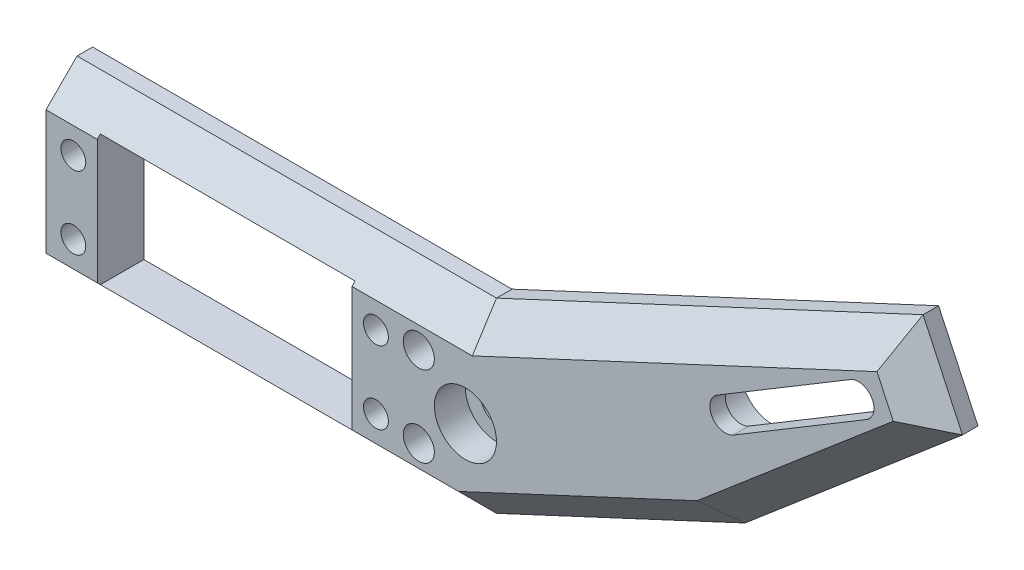
from build123d import *

# Parameters (mm, degrees)
SKETCH1_W                = 57.5
SKETCH1_H                = 30
BOSS_EXTRUDE1_DEPTH      = 30
SKETCH2_W                = 41
SKETCH2_H                = 21
CUT_EXTRUDE1_DEPTH       = 25
SKETCH8_R                = 2
CUT_EXTRUDE6_DEPTH       = 10
SKETCH10_R               = 5
CUT_EXTRUDE8_DEPTH       = 10
BOSS_EXTRUDE4_DEPTH      = 30
SKETCH16_R               = 5
CUT_EXTRUDE10_DEPTH      = 30
CHAMFER5_SIZE            = 5
SKETCH19_R               = 2.5
CUT_EXTRUDE12_DEPTH      = 30
SKETCH20_R               = 7.5
CUT_EXTRUDE13_DEPTH      = 2.5
CUT_EXTRUDE15_DEPTH      = 122.918629513
CUT_EXTRUDE15_DEPTH_BACK = 122.918629513
SKETCH29_W               = 67.5
SKETCH29_H               = 17.5
CUT_EXTRUDE16_DEPTH      = 124.312257678
SKETCH32_R               = 5
CUT_EXTRUDE18_DEPTH      = 5
CUT_EXTRUDE19_DEPTH      = 5


with BuildPart() as part:
    # Sketch1 → Boss-Extrude1 (new body)
    with BuildSketch(Plane.XY):
        Rectangle(SKETCH1_W, SKETCH1_H)
    extrude(amount=BOSS_EXTRUDE1_DEPTH)

    # Sketch2 → Cut-Extrude1 (cut)
    with BuildSketch(Plane.XY.offset(30)):
        Rectangle(SKETCH2_W, SKETCH2_H)
    extrude(amount=-CUT_EXTRUDE1_DEPTH, mode=Mode.SUBTRACT)

    # Sketch8 → Cut-Extrude6 (cut)
    with BuildSketch(Plane.XY.offset(30)):
        with Locations((24.35, 5.85)):
            Circle(SKETCH8_R)
        with Locations(Location((24.35, -5.85, 0), (0, 0, 180))):
            Circle(SKETCH8_R)
        with Locations((-24.35, -5.85)):
            Circle(SKETCH8_R)
        with Locations(Location((-24.35, 5.85, 0), (0, 0, 180))):
            Circle(SKETCH8_R)
    extrude(amount=-CUT_EXTRUDE6_DEPTH, mode=Mode.SUBTRACT)

    # Sketch10 → Cut-Extrude8 (cut)
    with BuildSketch(Plane.XY.offset(5)):
        with Locations((-10, 0)):
            Circle(SKETCH10_R)
    extrude(amount=-CUT_EXTRUDE8_DEPTH, mode=Mode.SUBTRACT)

    # Sketch13 → Boss-Extrude4 (add)
    with BuildSketch(Plane.XY.offset(30)):
        Polygon((28.75, 15), (38.75, 15), (107.410726074, 47.017022383), (113.75, 33.422405577), (78.75, 3.652306326), (38.75, -15), (28.75, -15), align=None)
    extrude(amount=-BOSS_EXTRUDE4_DEPTH)

    # Sketch16 → Cut-Extrude10 (cut)
    with BuildSketch(Plane(origin=(1.175656739, -2.521204013, 0), x_dir=(0.9063077870366488, 0.42261826174070183, 0), z_dir=(-0.42261826174070183, 0.9063077870366488, 0))):
        with Locations(Location((97.217429724, -15, 0), (0, 0, 180))):
            Circle(SKETCH16_R)
        with BuildLine():
            Line((67.217429724, -12.5), (82.217429724, -12.5))
            ThreePointArc((82.217429724, -12.5), (84.717429724, -15), (82.217429724, -17.5))
            Line((82.217429724, -17.5), (67.217429724, -17.5))
            ThreePointArc((67.217429724, -17.5), (64.717429724, -15), (67.217429724, -12.5))
        make_face()
    extrude(amount=-CUT_EXTRUDE10_DEPTH, mode=Mode.SUBTRACT)

    # Chamfer5
    # the kernel refuses this chamfer: 5 mm, written as the material it takes off along each edge
    with BuildSketch(Plane(origin=(-28.75, 27.85841494, 0), x_dir=(-0.027495876610586317, 0, 0.9996219169112968), z_dir=(0, -1, 0))) as chamfer5_piece_1:
        Polygon((CHAMFER5_SIZE * 0.999621916911, -CHAMFER5_SIZE * 0.0274958766106), (-CHAMFER5_SIZE * 0.0274958766106, -CHAMFER5_SIZE * 0.999621916911), (0, 0), align=None)
    extrude(amount=55.71682988, mode=Mode.SUBTRACT)
    with BuildSketch(Plane(origin=(-41.60841494, -15, 0), x_dir=(0, -0.027495876610586317, 0.9996219169112968), z_dir=(1, 0, 0)), Plane(origin=(51.60841494, -15, 30), x_dir=(0, -0.027495876610586317, -0.9996219169112968), z_dir=(-1, 0, 0))) as chamfer5_piece_2:
        Polygon((CHAMFER5_SIZE * 0.999621916911, -CHAMFER5_SIZE * 0.0274958766106), (-CHAMFER5_SIZE * 0.0274958766106, -CHAMFER5_SIZE * 0.999621916911), (0, 0), align=None)
    extrude(amount=93.21682988, mode=Mode.SUBTRACT)
    with BuildSketch(Plane(origin=(90.403681589, 9.086507297, 0), x_dir=(0.011620259578202724, -0.024919727083573626, 0.9996219169112968), z_dir=(-0.9063077870366526, -0.4226182617406939, 0)), Plane(origin=(90.403681589, 9.086507297, 30), x_dir=(-0.4224584769229526, 0.905965127389214, 0.02749587661058631), z_dir=(-0.9063077870366526, -0.4226182617406939, 0))) as chamfer5_piece_3:
        Polygon((CHAMFER5_SIZE * 0.999621916911, CHAMFER5_SIZE * 0.0274958766106), (-CHAMFER5_SIZE * 0.0274958766106, CHAMFER5_SIZE * 0.999621916911), (0, 0), align=None)
    extrude(amount=69.851946638, mode=Mode.SUBTRACT)
    with BuildSketch(Plane(origin=(123.544555766, 41.753402643, 0), x_dir=(-0.6476573741944397, 0.7614354223576539, -0.027495876610586414), z_dir=(-0.7617234170999287, -0.6479023351104763, 0))) as chamfer5_piece_4:
        Polygon((CHAMFER5_SIZE * 0.999621916911, -CHAMFER5_SIZE * 0.0274958766106), (-CHAMFER5_SIZE * 0.0274958766106, -CHAMFER5_SIZE * 0.999621916911), (0, 0), align=None)
    extrude(amount=71.665266299, mode=Mode.SUBTRACT)
    with BuildSketch(Plane(origin=(101.976525103, 58.670703972, 0), x_dir=(-0.9059651273892108, -0.42245847692295924, -0.027495876610586344), z_dir=(0.42261826174070055, -0.9063077870366495, 0))) as chamfer5_piece_5:
        Polygon((CHAMFER5_SIZE * 0.999621916911, -CHAMFER5_SIZE * 0.0274958766106), (-CHAMFER5_SIZE * 0.0274958766106, -CHAMFER5_SIZE * 0.999621916911), (0, 0), align=None)
    extrude(amount=40.71682988, mode=Mode.SUBTRACT)
    with BuildSketch(Plane(origin=(27.096318411, 9.565799029, 0), x_dir=(0.4224584769229604, -0.9059651273892103, -0.02749587661058636), z_dir=(0.9063077870366489, 0.4226182617407018, 0))) as chamfer5_piece_6_section:
        Polygon((CHAMFER5_SIZE * 0.999621916911, -CHAMFER5_SIZE * 0.0274958766106), (-CHAMFER5_SIZE * 0.0274958766106, -CHAMFER5_SIZE * 0.999621916911), (0, 0), align=None)
    chamfer5_piece_6 = extrude(amount=101.47555893, mode=Mode.PRIVATE)
    chamfer5_piece_6 = split(chamfer5_piece_6, bisect_by=Plane(origin=(81.150743587, 15, 1.670360501), z_dir=(0, 1, 0)), keep=Keep.TOP, mode=Mode.PRIVATE)
    add(chamfer5_piece_6, mode=Mode.SUBTRACT)
    with BuildSketch(Plane(origin=(-41.60841494, 15, 0), x_dir=(0, -0.9996219169112968, -0.027495876610586372), z_dir=(1, 0, 0))) as chamfer5_piece_7_section:
        Polygon((CHAMFER5_SIZE * 0.999621916911, -CHAMFER5_SIZE * 0.0274958766106), (-CHAMFER5_SIZE * 0.0274958766106, -CHAMFER5_SIZE * 0.999621916911), (0, 0), align=None)
    chamfer5_piece_7 = extrude(amount=93.21682988, mode=Mode.PRIVATE)
    chamfer5_piece_7 = split(chamfer5_piece_7, bisect_by=Plane(origin=(3.719146846, -1.335155097, 1.672660276), z_dir=(-0.4226182617407018, 0.9063077870366489, 0)), keep=Keep.TOP, mode=Mode.PRIVATE)
    add(chamfer5_piece_7, mode=Mode.SUBTRACT)
    with BuildSketch(Plane(origin=(51.60841494, 15, 30), x_dir=(0, -0.9996219169112968, 0.027495876610586317), z_dir=(-1, 0, 0))) as chamfer5_piece_8_section:
        Polygon((CHAMFER5_SIZE * 0.999621916911, -CHAMFER5_SIZE * 0.0274958766106), (-CHAMFER5_SIZE * 0.0274958766106, -CHAMFER5_SIZE * 0.999621916911), (0, 0), align=None)
    chamfer5_piece_8 = extrude(amount=93.21682988, mode=Mode.PRIVATE)
    chamfer5_piece_8 = split(chamfer5_piece_8, bisect_by=Plane(origin=(3.719146846, -1.335155097, 28.327339724), z_dir=(-0.4226182617407018, 0.9063077870366489, 0)), keep=Keep.TOP, mode=Mode.PRIVATE)
    add(chamfer5_piece_8, mode=Mode.SUBTRACT)
    with BuildSketch(Plane(origin=(123.544555766, 41.753402643, 30), x_dir=(-0.6476573741944397, 0.7614354223576539, 0.02749587661058634), z_dir=(-0.7617234170999287, -0.6479023351104763, 0))) as chamfer5_piece_9:
        Polygon((CHAMFER5_SIZE * 0.999621916911, CHAMFER5_SIZE * 0.0274958766106), (-CHAMFER5_SIZE * 0.0274958766106, CHAMFER5_SIZE * 0.999621916911), (0, 0), align=None)
    extrude(amount=71.665266299, mode=Mode.SUBTRACT)
    with BuildSketch(Plane(origin=(27.096318411, 9.565799029, 30), x_dir=(0.4224584769229604, -0.9059651273892103, 0.027495876610586313), z_dir=(0.9063077870366489, 0.4226182617407018, 0))) as chamfer5_piece_10_section:
        Polygon((CHAMFER5_SIZE * 0.999621916911, CHAMFER5_SIZE * 0.0274958766106), (-CHAMFER5_SIZE * 0.0274958766106, CHAMFER5_SIZE * 0.999621916911), (0, 0), align=None)
    chamfer5_piece_10 = extrude(amount=101.47555893, mode=Mode.PRIVATE)
    chamfer5_piece_10 = split(chamfer5_piece_10, bisect_by=Plane(origin=(81.150743587, 15, 28.329639499), z_dir=(0, 1, 0)), keep=Keep.TOP, mode=Mode.PRIVATE)
    add(chamfer5_piece_10, mode=Mode.SUBTRACT)
    with BuildSketch(Plane(origin=(101.976525103, 58.670703972, 30), x_dir=(-0.9059651273892108, -0.42245847692295924, 0.027495876610586337), z_dir=(0.42261826174070055, -0.9063077870366495, 0))) as chamfer5_piece_11:
        Polygon((CHAMFER5_SIZE * 0.999621916911, CHAMFER5_SIZE * 0.0274958766106), (-CHAMFER5_SIZE * 0.0274958766106, CHAMFER5_SIZE * 0.999621916911), (0, 0), align=None)
    extrude(amount=40.71682988, mode=Mode.SUBTRACT)
    with BuildSketch(Plane(origin=(27.096318411, 9.565799029, 0), x_dir=(0.4224584769229604, -0.9059651273892103, -0.02749587661058636), z_dir=(0.9063077870366489, 0.4226182617407018, 0))) as chamfer5_piece_12a_section:
        Polygon((CHAMFER5_SIZE * 0.999621916911, -CHAMFER5_SIZE * 0.0274958766106), (-CHAMFER5_SIZE * 0.0274958766106, -CHAMFER5_SIZE * 0.999621916911), (0, 0), align=None)
    chamfer5_piece_12a = extrude(amount=101.47555893, mode=Mode.PRIVATE)
    chamfer5_piece_12a = split(chamfer5_piece_12a, bisect_by=Plane(origin=(35.512062488, 15, 1.537951212), z_dir=(0, -1, 0)), keep=Keep.TOP, mode=Mode.PRIVATE)
    with BuildSketch(Plane(origin=(-41.60841494, 15, 0), x_dir=(0, -0.9996219169112968, -0.027495876610586372), z_dir=(1, 0, 0))) as chamfer5_piece_12b_section:
        Polygon((CHAMFER5_SIZE * 0.999621916911, -CHAMFER5_SIZE * 0.0274958766106), (-CHAMFER5_SIZE * 0.0274958766106, -CHAMFER5_SIZE * 0.999621916911), (0, 0), align=None)
    chamfer5_piece_12b = extrude(amount=93.21682988, mode=Mode.PRIVATE)
    chamfer5_piece_12b = split(chamfer5_piece_12b, bisect_by=Plane(origin=(41.684567981, 16.368411523, 1.537951212), z_dir=(0.4226182617407018, -0.9063077870366489, 0)), keep=Keep.TOP, mode=Mode.PRIVATE)
    chamfer5_piece_12 = chamfer5_piece_12a & chamfer5_piece_12b
    add(chamfer5_piece_12, mode=Mode.SUBTRACT)
    with BuildSketch(Plane(origin=(27.096318411, 9.565799029, 30), x_dir=(0.4224584769229604, -0.9059651273892103, 0.027495876610586313), z_dir=(0.9063077870366489, 0.4226182617407018, 0))) as chamfer5_piece_13a_section:
        Polygon((CHAMFER5_SIZE * 0.999621916911, CHAMFER5_SIZE * 0.0274958766106), (-CHAMFER5_SIZE * 0.0274958766106, CHAMFER5_SIZE * 0.999621916911), (0, 0), align=None)
    chamfer5_piece_13a = extrude(amount=101.47555893, mode=Mode.PRIVATE)
    chamfer5_piece_13a = split(chamfer5_piece_13a, bisect_by=Plane(origin=(35.512062488, 15, 28.462048788), z_dir=(0, -1, 0)), keep=Keep.TOP, mode=Mode.PRIVATE)
    with BuildSketch(Plane(origin=(51.60841494, 15, 30), x_dir=(0, -0.9996219169112968, 0.027495876610586317), z_dir=(-1, 0, 0))) as chamfer5_piece_13b_section:
        Polygon((CHAMFER5_SIZE * 0.999621916911, -CHAMFER5_SIZE * 0.0274958766106), (-CHAMFER5_SIZE * 0.0274958766106, -CHAMFER5_SIZE * 0.999621916911), (0, 0), align=None)
    chamfer5_piece_13b = extrude(amount=93.21682988, mode=Mode.PRIVATE)
    chamfer5_piece_13b = split(chamfer5_piece_13b, bisect_by=Plane(origin=(41.684567981, 16.368411523, 28.462048788), z_dir=(0.4226182617407018, -0.9063077870366489, 0)), keep=Keep.TOP, mode=Mode.PRIVATE)
    chamfer5_piece_13 = chamfer5_piece_13a & chamfer5_piece_13b
    add(chamfer5_piece_13, mode=Mode.SUBTRACT)

    # Sketch19 → Cut-Extrude12 (cut)
    with BuildSketch(Plane.XY.offset(30)):
        with Locations((38.75, 0)):
            Circle(SKETCH19_R)
        with Locations((31.25, 6.5)):
            Circle(SKETCH19_R)
        with Locations(Location((31.25, -6.5, 0), (0, 0, 180))):
            Circle(SKETCH19_R)
    extrude(amount=-CUT_EXTRUDE12_DEPTH, mode=Mode.SUBTRACT)

    # Sketch20 → Cut-Extrude13 (cut)
    with BuildSketch(Plane.XY.offset(5)):
        with Locations((-10, 0)):
            Circle(SKETCH20_R)
    extrude(amount=-CUT_EXTRUDE13_DEPTH, mode=Mode.SUBTRACT)

    # Sketch29 → Cut-Extrude15 (cut, two sides: drawn at the far end of the back side and taken through both)
    with BuildSketch(Plane(origin=(0, 15, 0), x_dir=(1, 0, 0), z_dir=(0, 1, 0)).offset(-CUT_EXTRUDE15_DEPTH_BACK)):
        with Locations((5, -13.75)):
            Rectangle(SKETCH29_W, SKETCH29_H)
        Polygon((38.75, -22.5), (113.75, -22.5), (113.75, 0), (-28.75, 0), (-28.75, -5), (38.75, -5), align=None)
    extrude(amount=CUT_EXTRUDE15_DEPTH + CUT_EXTRUDE15_DEPTH_BACK, mode=Mode.SUBTRACT)

    # Sketch30 → Cut-Extrude16 (cut, through all)
    with BuildSketch(Plane.XY.offset(30)):
        with BuildLine():
            Line((79.297644941, 24.259194476), (100.726827459, 37.135146348))
            ThreePointArc((100.726827459, 37.135146348), (104.157340898, 36.279823284), (103.302017833, 32.849309845))
            Line((103.302017833, 32.849309845), (81.872835316, 19.973357972))
            ThreePointArc((81.872835316, 19.973357972), (78.442321877, 20.828681036), (79.297644941, 24.259194476))
        make_face()
    extrude(amount=-CUT_EXTRUDE16_DEPTH, mode=Mode.SUBTRACT)

    # Sketch32 → Cut-Extrude18 (cut)
    with BuildSketch(Plane.XY.offset(30)):
        with Locations((38.75, 0)):
            Circle(SKETCH32_R)
    extrude(amount=-CUT_EXTRUDE18_DEPTH, mode=Mode.SUBTRACT)

    # Sketch36 → Cut-Extrude19 (cut)
    with BuildSketch(Plane(origin=(0, 0, 22.5), x_dir=(-1, 0, 0), z_dir=(0, 0, -1))):
        with BuildLine():
            Line((-99.439232272, 39.2780646), (-78.010049754, 26.402112727))
            ThreePointArc((-78.010049754, 26.402112727), (-76.299403625, 19.541085849), (-83.160430503, 17.83043972))
            Line((-83.160430503, 17.83043972), (-104.589613021, 30.706391593))
            ThreePointArc((-104.589613021, 30.706391593), (-106.30025915, 37.567418471), (-99.439232272, 39.2780646))
        make_face()
    extrude(amount=-CUT_EXTRUDE19_DEPTH, mode=Mode.SUBTRACT)


solid = part.part
